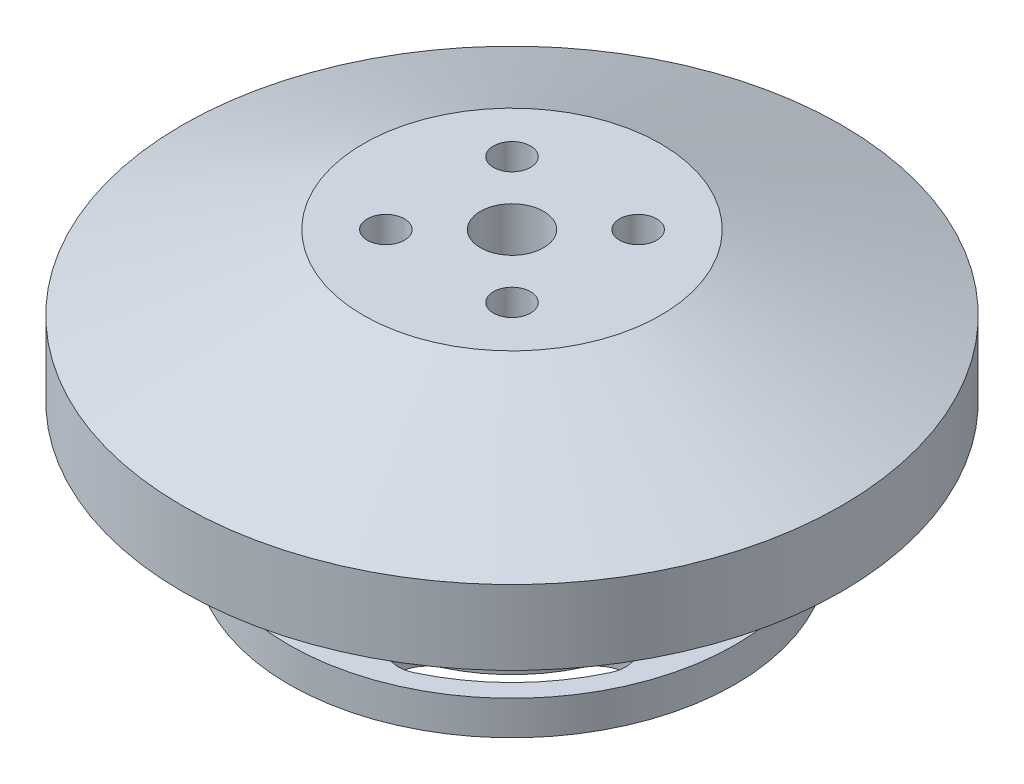
from build123d import *

# Parameters (mm, degrees)
ESQUISSE1_R                = 22.175
BOSS_EXTRU_1_DEPTH         = 5
TROU_TARAUD_M31_D          = 2.5
TROU_TARAUD_M31_DEPTH      = 5.5
TROU_TARAUD_M31_TIP        = 0.751075774
BOSS_EXTRU_2_DEPTH         = 6.7
BOSS_EXTRU_2_DEPTH_BACK    = 5.5
ESQUISSE9_R                = 8
ESQUISSE10_R               = 15
BOSS_EXTRU_3_DEPTH         = 2.3
TROU_TARAUD_M32_AT_2_COUNT = 2
TROU_TARAUD_M32_AT_2_PITCH = 17.67766953
TROU_TARAUD_M32_AT_3_COUNT = 2
TROU_TARAUD_M32_AT_3_PITCH = 17.67766953
TROU_TARAUD_M32_AT_4_COUNT = 2
TROU_TARAUD_M32_AT_4_PITCH = 25
ENL_V_MAT_EXTRU_2_DEPTH    = 2.3
ESQUISSE14_R               = 2.125
ENL_V_MAT_EXTRU_3_DEPTH    = 37.666895833
ESQUISSE15_R               = 21
ENL_V_MAT_EXTRU_4_DEPTH    = 2.3
ESQUISSE16_OUTSIDE_W       = 59.458
ESQUISSE16_OUTSIDE_H       = 59.458
ESQUISSE16_OUTSIDE_R       = 7.5
ENL_V_MAT_EXTRU_5_DEPTH    = 6.3


with BuildPart() as part:
    # Esquisse1 → Boss.-Extru.1 (new body)
    with BuildSketch(Plane(origin=(0, 0, 0), x_dir=(1, 0, 0), z_dir=(0, 1, 0))):
        Circle(ESQUISSE1_R)
    extrude(amount=BOSS_EXTRU_1_DEPTH)

    # Esquisse2 → Révolution1 (revolve)
    with BuildSketch(Plane.XY):
        Polygon((0, 10), (-10, 10), (-22.175, 5), (0, 5), align=None)
    revolve(axis=Axis((0, 17.696721124, 0), (0, -1, 0)))

    # Trou taraudé M31
    with Locations(Plane(origin=(4.242640687, 10, -4.242640687), x_dir=(0, 0, 1), z_dir=(0, 1, 0))):
        with Locations((0, 0), (8.485281374, 0), (8.485281374, -8.485281374), (0, -8.485281374)):
            Hole(TROU_TARAUD_M31_D / 2, depth=TROU_TARAUD_M31_DEPTH)
            with Locations((0, 0, -(TROU_TARAUD_M31_DEPTH + TROU_TARAUD_M31_TIP / 2))):  # 118° drill point
                Cone(0, TROU_TARAUD_M31_D / 2, TROU_TARAUD_M31_TIP, mode=Mode.SUBTRACT)


with BuildPart() as body_2:
    # Esquisse9 → Boss.-Extru.2 (new, two sides: drawn at the far end of the back side and taken through both)
    with BuildSketch(Plane.XZ.offset(-BOSS_EXTRU_2_DEPTH_BACK)):
        Circle(ESQUISSE9_R)
    extrude(amount=BOSS_EXTRU_2_DEPTH + BOSS_EXTRU_2_DEPTH_BACK)

    # Esquisse10 → Boss.-Extru.3 (add)
    with BuildSketch(Plane.XZ.offset(6.7)):
        Circle(ESQUISSE10_R)
    extrude(amount=BOSS_EXTRU_3_DEPTH)

    # Esquisse12 → Trou taraudé M32 (revolve, cut)
    with BuildSketch(Plane(origin=(0, -9, 12.5), x_dir=(0, 0, -1), z_dir=(1, 0, 0))):
        Polygon((0, 0), (0, 6.251075774), (1.25, 5.5), (1.25, 0), align=None)
    trou_taraud_m32 = revolve(axis=Axis((0, -15.35, 12.5), (0, 1, 0)), mode=Mode.SUBTRACT)

    # Trou taraudé M32 at 2: Trou taraudé M32 ×2
    with Locations(*[Vector(0.7071067811865676, 0, -0.7071067811865276) * (i * TROU_TARAUD_M32_AT_2_PITCH) for i in range(1, TROU_TARAUD_M32_AT_2_COUNT)]):
        add(trou_taraud_m32, mode=Mode.SUBTRACT)

    # Trou taraudé M32 at 3: Trou taraudé M32 ×2
    with Locations(*[Vector(-0.7071067811865276, 0, -0.7071067811865676) * (i * TROU_TARAUD_M32_AT_3_PITCH) for i in range(1, TROU_TARAUD_M32_AT_3_COUNT)]):
        add(trou_taraud_m32, mode=Mode.SUBTRACT)

    # Trou taraudé M32 at 4: Trou taraudé M32 ×2
    with Locations(*[(0, 0, -i * TROU_TARAUD_M32_AT_4_PITCH) for i in range(1, TROU_TARAUD_M32_AT_4_COUNT)]):
        add(trou_taraud_m32, mode=Mode.SUBTRACT)

    # Esquisse13 → Enlèv. mat.-Extru.2 (cut)
    with BuildSketch(Plane.XZ.offset(9)):
        with BuildLine():
            ThreePointArc((-5.789870186, 12.416416682), (-9.687362902, 9.687362902), (-12.416416682, 5.789870186))
            ThreePointArc((-12.416416682, 5.789870186), (-11.473222108, 3.198464391), (-8.881816313, 4.141658965))
            ThreePointArc((-8.881816313, 4.141658965), (-6.929646456, 6.929646456), (-4.141658965, 8.881816313))
            ThreePointArc((-4.141658965, 8.881816313), (-3.198464391, 11.473222108), (-5.789870186, 12.416416682))
        make_face()
        with BuildLine():
            ThreePointArc((12.416416682, 5.789870186), (9.687362902, 9.687362902), (5.789870186, 12.416416682))
            ThreePointArc((5.789870186, 12.416416682), (3.198464391, 11.473222108), (4.141658965, 8.881816313))
            ThreePointArc((4.141658965, 8.881816313), (6.929646456, 6.929646456), (8.881816313, 4.141658965))
            ThreePointArc((8.881816313, 4.141658965), (11.473222108, 3.198464391), (12.416416682, 5.789870186))
        make_face()
        with BuildLine():
            ThreePointArc((5.789870186, -12.416416682), (9.687362902, -9.687362902), (12.416416682, -5.789870186))
            ThreePointArc((12.416416682, -5.789870186), (11.473222108, -3.198464391), (8.881816313, -4.141658965))
            ThreePointArc((8.881816313, -4.141658965), (6.929646456, -6.929646456), (4.141658965, -8.881816313))
            ThreePointArc((4.141658965, -8.881816313), (3.198464391, -11.473222108), (5.789870186, -12.416416682))
        make_face()
        with BuildLine():
            ThreePointArc((-12.416416682, -5.789870186), (-9.687362902, -9.687362902), (-5.789870186, -12.416416682))
            ThreePointArc((-5.789870186, -12.416416682), (-3.198464391, -11.473222108), (-4.141658965, -8.881816313))
            ThreePointArc((-4.141658965, -8.881816313), (-6.929646456, -6.929646456), (-8.881816313, -4.141658965))
            ThreePointArc((-8.881816313, -4.141658965), (-11.473222108, -3.198464391), (-12.416416682, -5.789870186))
        make_face()
    extrude(amount=-ENL_V_MAT_EXTRU_2_DEPTH, mode=Mode.SUBTRACT)


with BuildPart() as enl_v_mat_extru_3_tool:
    # Esquisse14 → Enlèv. mat.-Extru.3 (new, through all)
    with BuildSketch(Plane(origin=(0, 10, 0), x_dir=(1, 0, 0), z_dir=(0, 1, 0))):
        Circle(ESQUISSE14_R)
    extrude(amount=-ENL_V_MAT_EXTRU_3_DEPTH)


with BuildPart() as part_1:
    add(part.part)

    # Enlèv. mat.-Extru.3: cut by enl_v_mat_extru_3_tool
    add(enl_v_mat_extru_3_tool.part, mode=Mode.SUBTRACT)

    # Esquisse15 → Enlèv. mat.-Extru.4 (cut)
    with BuildSketch(Plane.XZ):
        Circle(ESQUISSE15_R)
    extrude(amount=-ENL_V_MAT_EXTRU_4_DEPTH, mode=Mode.SUBTRACT)


with BuildPart() as body_2_1:
    add(body_2.part)

    # Enlèv. mat.-Extru.3: cut by enl_v_mat_extru_3_tool
    add(enl_v_mat_extru_3_tool.part, mode=Mode.SUBTRACT)

    # Esquisse16 outside → Enlèv. mat.-Extru.5 (cut)
    with BuildSketch(Plane(origin=(0, 5.5, 0), x_dir=(1, 0, 0), z_dir=(0, 1, 0))):
        Rectangle(ESQUISSE16_OUTSIDE_W, ESQUISSE16_OUTSIDE_H)
        Circle(ESQUISSE16_OUTSIDE_R, mode=Mode.SUBTRACT)
    extrude(amount=-ENL_V_MAT_EXTRU_5_DEPTH, mode=Mode.SUBTRACT)


solid = Compound([part_1.part, body_2_1.part])
